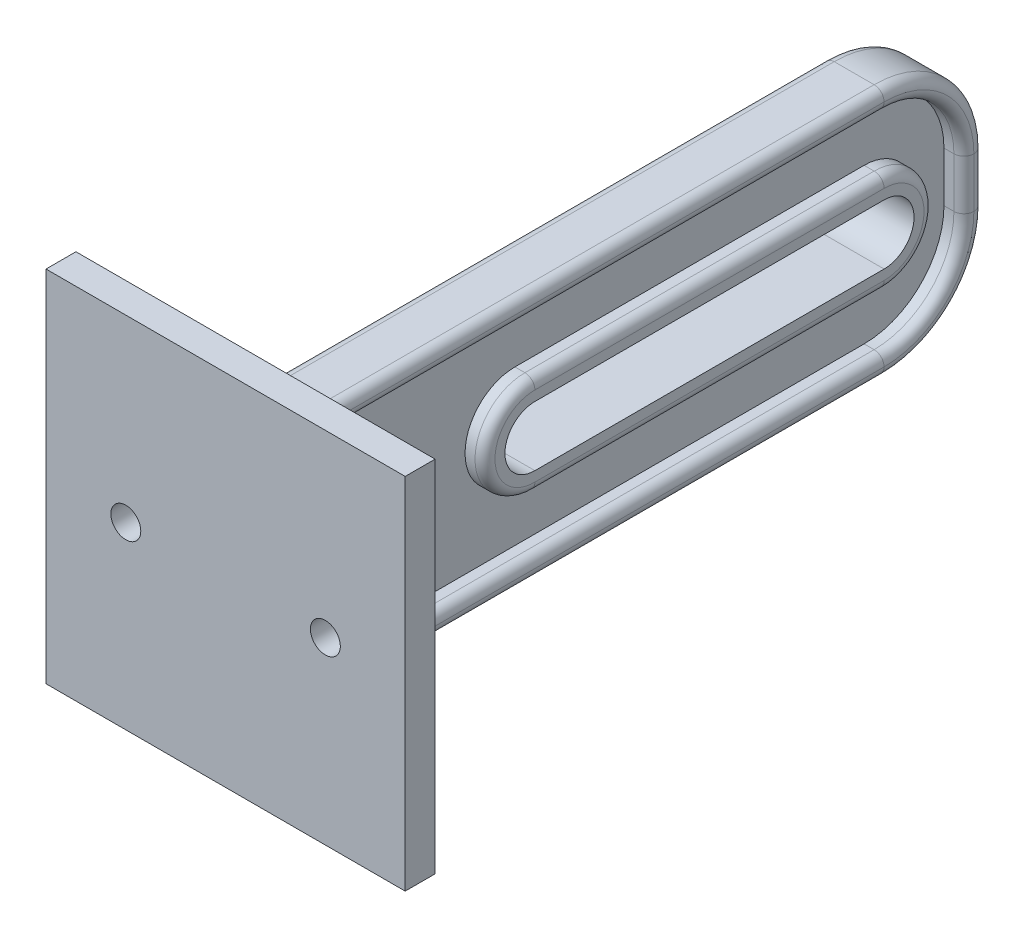
from build123d import *

# Parameters (mm, degrees)
SKETCH1_W           = 36
SKETCH1_H           = 36
BOSS_EXTRUDE1_DEPTH = 3
SKETCH2_R           = 1.5
CUT_EXTRUDE1_DEPTH  = 26.632011236
SKETCH3_W           = 6
SKETCH3_H           = 25
BOSS_EXTRUDE2_DEPTH = 70
FILLET1_R           = 10
CUT_EXTRUDE2_DEPTH  = 76.266194271
CUT_EXTRUDE3_DEPTH  = 2
FILLET2_R           = 1


with BuildPart() as part:
    # Sketch1 → Boss-Extrude1 (new body)
    with BuildSketch(Plane.XY):
        Rectangle(SKETCH1_W, SKETCH1_H)
    extrude(amount=BOSS_EXTRUDE1_DEPTH)

    # Sketch2 → Cut-Extrude1 (cut, through all)
    with BuildSketch(Plane.XY.offset(3)):
        with Locations((-10, 0)):
            Circle(SKETCH2_R)
        with Locations((10, 0)):
            Circle(SKETCH2_R)
    extrude(amount=-CUT_EXTRUDE1_DEPTH, mode=Mode.SUBTRACT)

    # Sketch3 → Boss-Extrude2 (add)
    with BuildSketch(Plane(origin=(0, 0, 0), x_dir=(-1, 0, 0), z_dir=(0, 0, -1))):
        Rectangle(SKETCH3_W, SKETCH3_H)
    extrude(amount=BOSS_EXTRUDE2_DEPTH)

    # Fillet1
    fillet1_edges = [part.edges().sort_by_distance(p)[0] for p in [
        (0, -12.5, -70),
        (0, 12.5, -70),
    ]]
    fillet(fillet1_edges, radius=FILLET1_R)

    # Sketch4 → Cut-Extrude2 (cut, through all)
    with BuildSketch(Plane.ZY.offset(3)):
        with BuildLine():
            Line((-60, -3), (-25, -3))
            ThreePointArc((-25, -3), (-22, 0), (-25, 3))
            Line((-25, 3), (-60, 3))
            ThreePointArc((-60, 3), (-63, 0), (-60, -3))
        make_face()
    extrude(amount=-CUT_EXTRUDE2_DEPTH, mode=Mode.SUBTRACT)

    # Sketch6 → Cut-Extrude3 (cut)
    with BuildSketch(Plane.ZY.offset(3)):
        with BuildLine():
            Line((-2, -10.5), (-2, 10.5))
            Line((-2, 10.5), (-60, 10.5))
            ThreePointArc((-60, 10.5), (-65.656854249, 8.156854249), (-68, 2.5))
            Line((-68, 2.5), (-68, -2.5))
            ThreePointArc((-68, -2.5), (-65.656854249, -8.156854249), (-60, -10.5))
            Line((-60, -10.5), (-2, -10.5))
        make_face()
        with BuildLine():
            Line((-60, -5), (-25, -5))
            ThreePointArc((-25, -5), (-20, 0), (-25, 5))
            Line((-25, 5), (-60, 5))
            ThreePointArc((-60, 5), (-65, 0), (-60, -5))
        make_face(mode=Mode.SUBTRACT)
    cut_extrude3 = extrude(amount=-CUT_EXTRUDE3_DEPTH, mode=Mode.SUBTRACT)

    # Mirror1: Cut-Extrude3 across plane
    add(cut_extrude3.mirror(Plane(origin=(0, 0, 0), x_dir=(0, 0, 1), z_dir=(1, 0, 0))), mode=Mode.SUBTRACT)

    # Fillet2
    fillet2_edges = [part.edges().sort_by_distance(p)[0] for p in [
        (-3, 0, 0),
        (0, 12.5, 0),
        (0, -12.5, 0),
        (-1, -5, -42.5),
        (-1, 0, -65),
        (-1, 5, -42.5),
        (-3, 12.5, -30),
        (-3, -12.5, -30),
        (-3, -9.571067812, -67.071067812),
        (-3, 0, -70),
        (-3, 10.5, -31),
        (-3, 8.156854249, -65.656854249),
        (-3, 0, -68),
        (-3, -10.5, -31),
        (3, 12.5, -30),
        (3, 9.571067812, -67.071067812),
        (3, 0, -70),
        (3, -9.571067812, -67.071067812),
        (3, 0, -20),
        (3, -5, -42.5),
        (3, 0, -65),
        (3, -10.5, -31),
        (3, -8.156854249, -65.656854249),
        (3, 0, -68),
        (3, 8.156854249, -65.656854249),
        (-1, 0, -2),
        (-1, 0, -20),
        (-3, 9.571067812, -67.071067812),
        (-3, -8.156854249, -65.656854249),
        (3, -12.5, -30),
        (3, 0, 0),
        (3, 0, -2),
        (1, 0, -2),
        (3, 5, -42.5),
        (3, 10.5, -31),
    ]]
    fillet(fillet2_edges, radius=FILLET2_R - 0.0001)  # a hair under: the kernel refuses the full size


solid = part.part
